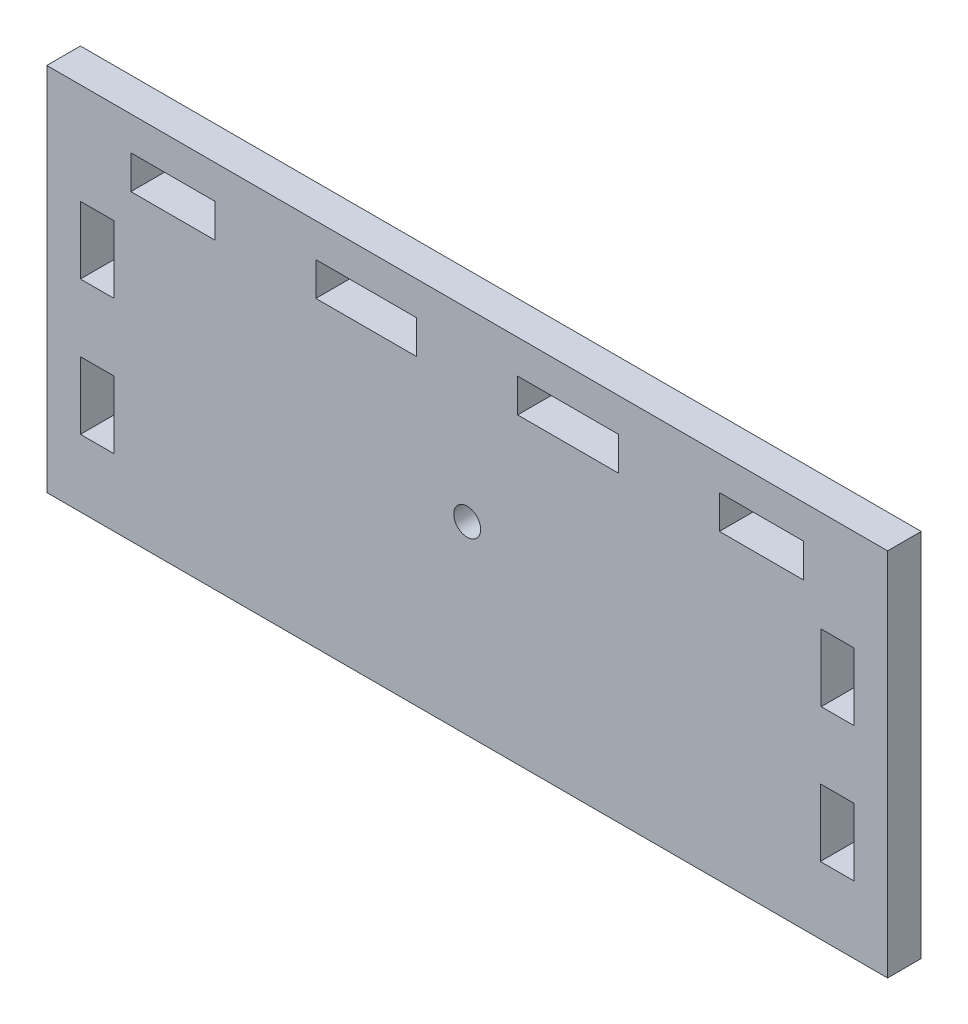
from build123d import *

# Parameters (mm, degrees)
ESQUISSE1_W             = 125
ESQUISSE1_H             = 55
BOSS_EXTRU_3_DEPTH      = 5
ESQUISSE2_R             = 2
ENL_V_MAT_EXTRU_1_DEPTH = 3
ESQUISSE3_W             = 4.868398839
ESQUISSE3_H             = 10
ESQUISSE3_W_2           = 5
ESQUISSE3_W_3           = 12.5
ESQUISSE3_H_2           = 5
ESQUISSE3_W_4           = 15
ENL_V_MAT_EXTRU_2_DEPTH = 5


with BuildPart() as part:
    # Esquisse1 → Boss.-Extru.3 (new body)
    with BuildSketch(Plane.XY):
        with Locations((-4.111168033, 9.879807692)):
            Rectangle(ESQUISSE1_W, ESQUISSE1_H)
    extrude(amount=BOSS_EXTRU_3_DEPTH)

    # Esquisse2 → Enlèv. mat.-Extru.1 (cut)
    with BuildSketch(Plane.XY.offset(5)):
        with Locations((-4.111168033, 9.879807692)):
            Circle(ESQUISSE2_R)
    extrude(amount=-ENL_V_MAT_EXTRU_1_DEPTH, mode=Mode.SUBTRACT)

    # Esquisse3 → Enlèv. mat.-Extru.2 (cut)
    with BuildSketch(Plane.XY.offset(5)):
        with Locations((50.954632547, 17.379807692)):
            Rectangle(ESQUISSE3_W, ESQUISSE3_H)
        with Locations((50.888831967, -2.620192308)):
            Rectangle(ESQUISSE3_W_2, ESQUISSE3_H)
        with Locations((-59.111168033, 17.379807692)):
            Rectangle(ESQUISSE3_W_2, ESQUISSE3_H)
        with Locations((-59.111168033, -2.620192308)):
            Rectangle(ESQUISSE3_W_2, ESQUISSE3_H)
        with Locations((-47.861168033, 29.879807692)):
            Rectangle(ESQUISSE3_W_3, ESQUISSE3_H_2)
        with Locations((-19.111168033, 29.879807692)):
            Rectangle(ESQUISSE3_W_4, ESQUISSE3_H_2)
        with Locations((10.888831967, 29.879807692)):
            Rectangle(ESQUISSE3_W_4, ESQUISSE3_H_2)
        with Locations((39.638831967, 29.879807692)):
            Rectangle(ESQUISSE3_W_3, ESQUISSE3_H_2)
    extrude(amount=-ENL_V_MAT_EXTRU_2_DEPTH, mode=Mode.SUBTRACT)


solid = part.part
